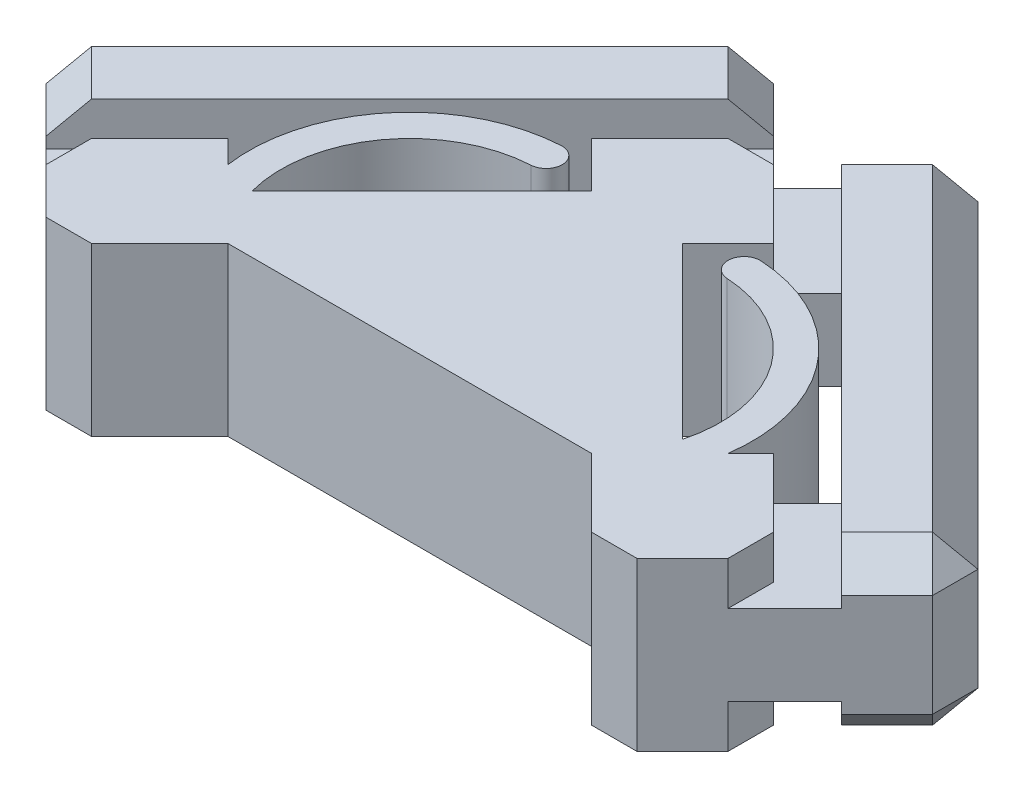
from build123d import *

# Parameters (mm, degrees)
BOSS_EXTRUDE1_DEPTH      = 2.6
BOSS_EXTRUDE2_DEPTH      = 4
SKETCH3_W                = 3
SKETCH3_H                = 5.2
BOSS_EXTRUDE3_DEPTH      = 8
BOSS_EXTRUDE4_DEPTH      = 2.6
CHAMFER1_SIZE            = 1
MIRROR2_COPY_1_DEPTH     = 4
CHAMFER1_OF_MIRROR2_SIZE = 1
CHAMFER2_SIZE            = 1


with BuildPart() as part:
    # Sketch1 → Boss-Extrude1 (new, symmetric)
    with BuildSketch(Plane(origin=(0, 0, 0), x_dir=(1, 0, 0), z_dir=(0, 1, 0))):
        Polygon((0, 0), (-2.828427125, -2.828427125), (-1.414213562, -4.242640687), (-7.071067812, -9.899494937), (-8.485281374, -8.485281374), (-11.313708499, -11.313708499), (-8.485281374, -14.142135624), (-5.656854249, -11.313708499), (5.656854249, -11.313708499), (8.485281374, -14.142135624), (11.313708499, -11.313708499), (8.485281374, -8.485281374), (7.071067812, -9.899494937), (1.414213562, -4.242640687), (2.828427125, -2.828427125), align=None)
    extrude(amount=BOSS_EXTRUDE1_DEPTH, both=True)

    # Sketch2 → Boss-Extrude2 (add)
    with BuildSketch(Plane(origin=(-11.313708499, 0, 11.313708499), x_dir=(0.7071067811865501, 0, 0.7071067811865449), z_dir=(-0.7071067811865449, 0, 0.7071067811865501))):
        Polygon((-1.5, -1.25), (-1.5, -2.6), (-4.5, -2.6), (-4.5, 2.6), (-1.5, 2.6), (-1.5, 1.25), (0, 1.25), (0, -1.25), align=None)
    boss_extrude2 = extrude(amount=-BOSS_EXTRUDE2_DEPTH)

    # Mirror1: Boss-Extrude2 across plane
    add(boss_extrude2.mirror(Plane(origin=(-5.656854249, 0, 5.656854249), x_dir=(0.707106781186549, 0, 0.707106781186546), z_dir=(-0.707106781186546, 0, 0.707106781186549))))

    # Sketch3 → Boss-Extrude3 (add)
    with BuildSketch(Plane(origin=(-2.828427125, 0, 2.828427125), x_dir=(0.7071067811865493, 0, 0.7071067811865457), z_dir=(-0.7071067811865457, 0, 0.7071067811865493))):
        with Locations((-3, 0)):
            Rectangle(SKETCH3_W, SKETCH3_H)
    boss_extrude3 = extrude(amount=BOSS_EXTRUDE3_DEPTH)

    # Sketch4 → Boss-Extrude4 (add, symmetric)
    with BuildSketch(Plane(origin=(0, 0, 0), x_dir=(1, 0, 0), z_dir=(0, 1, 0))):
        with BuildLine():
            Line((-7.778174593, -9.192388155), (-7.071067812, -9.899494937))
            Line((-7.071067812, -9.899494937), (-6.69213043, -9.520557555))
            ThreePointArc((-6.69213043, -9.520557555), (-6.068382545, -6.139500295), (-3.050994148, -4.491478184))
            ThreePointArc((-3.050994148, -4.491478184), (-2.579589628, -3.964431908), (-3.106635904, -3.493027387))
            ThreePointArc((-3.106635904, -3.493027387), (-6.695410435, -5.315669399), (-7.778174593, -9.192388155))
        make_face()
    boss_extrude4 = extrude(amount=BOSS_EXTRUDE4_DEPTH, both=True)

    # Chamfer1
    chamfer1_edges = [part.edges().sort_by_distance(p)[0] for p in [
        (-8.838834765, -2.6, 2.474873734),
        (-8.838834765, 2.6, 2.474873734),
        (-14.495689014, 0, 8.131727984),
        (-13.435028843, -2.6, 9.192388155),
        (-13.435028843, 2.6, 9.192388155),
        (-3.181980515, 0, -3.181980515),
        (-2.121320344, -2.6, -2.121320344),
        (-2.121320344, 2.6, -2.121320344),
    ]]
    chamfer(chamfer1_edges, length=CHAMFER1_SIZE)

    # Mirror2: Boss-Extrude2, Boss-Extrude3, Boss-Extrude4 across plane
    add(boss_extrude2.mirror(Plane(origin=(0, 0, 0), x_dir=(0, 0, 1), z_dir=(1, 0, 0))))
    add(boss_extrude3.mirror(Plane(origin=(0, 0, 0), x_dir=(0, 0, 1), z_dir=(1, 0, 0))))
    add(boss_extrude4.mirror(Plane(origin=(0, 0, 0), x_dir=(0, 0, 1), z_dir=(1, 0, 0))))

    # Mirror2 copy 1 sketch → Mirror2 copy 1 (add)
    with BuildSketch(Plane(origin=(0, 0, 0), x_dir=(-0.7071067811865479, 0, 0.7071067811865471), z_dir=(-0.7071067811865471, 0, -0.7071067811865479))):
        Polygon((-1.5, -1.25), (-1.5, -2.6), (-4.5, -2.6), (-4.5, 2.6), (-1.5, 2.6), (-1.5, 1.25), (0, 1.25), (0, -1.25), align=None)
    extrude(amount=-MIRROR2_COPY_1_DEPTH)

    # Chamfer1 of Mirror2
    chamfer1_of_mirror2_edges = [part.edges().sort_by_distance(p)[0] for p in [
        (8.838834765, -2.6, 2.474873734),
        (8.838834765, 2.6, 2.474873734),
        (14.495689014, 0, 8.131727984),
        (13.435028843, -2.6, 9.192388155),
        (13.435028843, 2.6, 9.192388155),
        (3.181980515, 0, -3.181980515),
        (2.121320344, -2.6, -2.121320344),
        (2.121320344, 2.6, -2.121320344),
    ]]
    chamfer(chamfer1_of_mirror2_edges, length=CHAMFER1_OF_MIRROR2_SIZE)

    # Chamfer2
    # the kernel refuses this chamfer: 1 mm, written as the material it takes off along each edge
    with BuildSketch(Plane(origin=(11.313708499, -5.171682988, 11.313708499), x_dir=(-0.6873969152646685, 0, 0.7262819568766788), z_dir=(0, 1, 0)), Plane(origin=(11.313708499, 1.25, 11.313708499), x_dir=(-0.6873969152646685, 0, 0.7262819568766788), z_dir=(0, 1, 0)), Plane(origin=(0, 5.171682988, 0), x_dir=(-0.7262819568766743, 0, 0.6873969152646733), z_dir=(0, -1, 0)), Plane(origin=(-11.313708499, -5.171682988, 11.313708499), x_dir=(0.6873969152646597, 0, -0.7262819568766873), z_dir=(0, 1, 0)), Plane(origin=(0, -1.25, 0), x_dir=(-0.7262819568766743, 0, 0.6873969152646733), z_dir=(0, -1, 0))) as chamfer2_piece_1:
        Polygon((CHAMFER2_SIZE * 0.999621916911, -CHAMFER2_SIZE * 0.0274958766106), (-CHAMFER2_SIZE * 0.0274958766106, -CHAMFER2_SIZE * 0.999621916911), (0, 0), align=None)
    extrude(amount=3.921682988, mode=Mode.SUBTRACT)
    with BuildSketch(Plane(origin=(11.313708499, -5.171682988, 11.313708499), x_dir=(-0.6873969152646685, 0, 0.7262819568766788), z_dir=(0, 1, 0))) as chamfer2_piece_2_section:
        Polygon((CHAMFER2_SIZE * 0.999621916911, -CHAMFER2_SIZE * 0.0274958766106), (-CHAMFER2_SIZE * 0.0274958766106, -CHAMFER2_SIZE * 0.999621916911), (0, 0), align=None)
    chamfer2_piece_2 = extrude(amount=6.493365976, mode=Mode.PRIVATE)
    chamfer2_piece_2 = split(chamfer2_piece_2, bisect_by=Plane(origin=(10.847309879, 1.25, 11.313708499), z_dir=(0, 1, 0)), keep=Keep.TOP, mode=Mode.PRIVATE)
    add(chamfer2_piece_2, mode=Mode.SUBTRACT)
    with BuildSketch(Plane(origin=(11.313708499, -1.321682988, 11.313708499), x_dir=(-0.6873969152646685, 0, 0.7262819568766788), z_dir=(0, 1, 0))) as chamfer2_piece_3_section:
        Polygon((CHAMFER2_SIZE * 0.999621916911, -CHAMFER2_SIZE * 0.0274958766106), (-CHAMFER2_SIZE * 0.0274958766106, -CHAMFER2_SIZE * 0.999621916911), (0, 0), align=None)
    chamfer2_piece_3 = extrude(amount=6.493365976, mode=Mode.PRIVATE)
    chamfer2_piece_3 = split(chamfer2_piece_3, bisect_by=Plane(origin=(10.847309879, -1.25, 11.313708499), z_dir=(0, -1, 0)), keep=Keep.TOP, mode=Mode.PRIVATE)
    add(chamfer2_piece_3, mode=Mode.SUBTRACT)
    with BuildSketch(Plane(origin=(8.485281374, -5.171682988, 14.142135624), x_dir=(0.7262819568766956, 0, -0.6873969152646507), z_dir=(0, 1, 0))) as chamfer2_piece_4:
        Polygon((CHAMFER2_SIZE * 0.999621916911, CHAMFER2_SIZE * 0.0274958766106), (-CHAMFER2_SIZE * 0.0274958766106, CHAMFER2_SIZE * 0.999621916911), (0, 0), align=None)
    extrude(amount=10.343365976, mode=Mode.SUBTRACT)
    with BuildSketch(Plane(origin=(-8.485281374, -5.171682988, 14.142135624), x_dir=(-0.7262819568766898, 0, -0.687396915264657), z_dir=(0, 1, 0))) as chamfer2_piece_5:
        Polygon((CHAMFER2_SIZE * 0.999621916911, -CHAMFER2_SIZE * 0.0274958766106), (-CHAMFER2_SIZE * 0.0274958766106, -CHAMFER2_SIZE * 0.999621916911), (0, 0), align=None)
    extrude(amount=10.343365976, mode=Mode.SUBTRACT)
    with BuildSketch(Plane(origin=(-11.313708499, -1.321682988, 11.313708499), x_dir=(0.6873969152646623, 0, 0.7262819568766848), z_dir=(0, 1, 0))) as chamfer2_piece_6_section:
        Polygon((CHAMFER2_SIZE * 0.999621916911, CHAMFER2_SIZE * 0.0274958766106), (-CHAMFER2_SIZE * 0.0274958766106, CHAMFER2_SIZE * 0.999621916911), (0, 0), align=None)
    chamfer2_piece_6 = extrude(amount=6.493365976, mode=Mode.PRIVATE)
    chamfer2_piece_6 = split(chamfer2_piece_6, bisect_by=Plane(origin=(-10.847309879, -1.25, 11.313708499), z_dir=(0, -1, 0)), keep=Keep.TOP, mode=Mode.PRIVATE)
    add(chamfer2_piece_6, mode=Mode.SUBTRACT)
    with BuildSketch(Plane(origin=(-11.313708499, 1.25, 11.313708499), x_dir=(0.6873969152646623, 0, 0.7262819568766848), z_dir=(0, 1, 0))) as chamfer2_piece_7:
        Polygon((CHAMFER2_SIZE * 0.999621916911, CHAMFER2_SIZE * 0.0274958766106), (-CHAMFER2_SIZE * 0.0274958766106, CHAMFER2_SIZE * 0.999621916911), (0, 0), align=None)
    extrude(amount=3.921682988, mode=Mode.SUBTRACT)
    with BuildSketch(Plane(origin=(0, 5.171682988, 0), x_dir=(-0.7262819568766743, 0, 0.6873969152646733), z_dir=(0, -1, 0))) as chamfer2_piece_8_section:
        Polygon((CHAMFER2_SIZE * 0.999621916911, -CHAMFER2_SIZE * 0.0274958766106), (-CHAMFER2_SIZE * 0.0274958766106, -CHAMFER2_SIZE * 0.999621916911), (0, 0), align=None)
    chamfer2_piece_8 = extrude(amount=6.493365976, mode=Mode.PRIVATE)
    chamfer2_piece_8 = split(chamfer2_piece_8, bisect_by=Plane(origin=(0, -1.25, 0.46639862), z_dir=(0, -1, 0)), keep=Keep.TOP, mode=Mode.PRIVATE)
    add(chamfer2_piece_8, mode=Mode.SUBTRACT)
    with BuildSketch(Plane(origin=(-11.313708499, -5.171682988, 11.313708499), x_dir=(0.6873969152646597, 0, -0.7262819568766873), z_dir=(0, 1, 0))) as chamfer2_piece_9_section:
        Polygon((CHAMFER2_SIZE * 0.999621916911, -CHAMFER2_SIZE * 0.0274958766106), (-CHAMFER2_SIZE * 0.0274958766106, -CHAMFER2_SIZE * 0.999621916911), (0, 0), align=None)
    chamfer2_piece_9 = extrude(amount=6.493365976, mode=Mode.PRIVATE)
    chamfer2_piece_9 = split(chamfer2_piece_9, bisect_by=Plane(origin=(-10.847309879, 1.25, 11.313708499), z_dir=(0, 1, 0)), keep=Keep.TOP, mode=Mode.PRIVATE)
    add(chamfer2_piece_9, mode=Mode.SUBTRACT)
    with BuildSketch(Plane(origin=(0, 1.321682988, 0), x_dir=(-0.7262819568766743, 0, 0.6873969152646733), z_dir=(0, -1, 0))) as chamfer2_piece_10_section:
        Polygon((CHAMFER2_SIZE * 0.999621916911, -CHAMFER2_SIZE * 0.0274958766106), (-CHAMFER2_SIZE * 0.0274958766106, -CHAMFER2_SIZE * 0.999621916911), (0, 0), align=None)
    chamfer2_piece_10 = extrude(amount=6.493365976, mode=Mode.PRIVATE)
    chamfer2_piece_10 = split(chamfer2_piece_10, bisect_by=Plane(origin=(0, 1.25, 0.46639862), z_dir=(0, 1, 0)), keep=Keep.TOP, mode=Mode.PRIVATE)
    add(chamfer2_piece_10, mode=Mode.SUBTRACT)


solid = part.part
